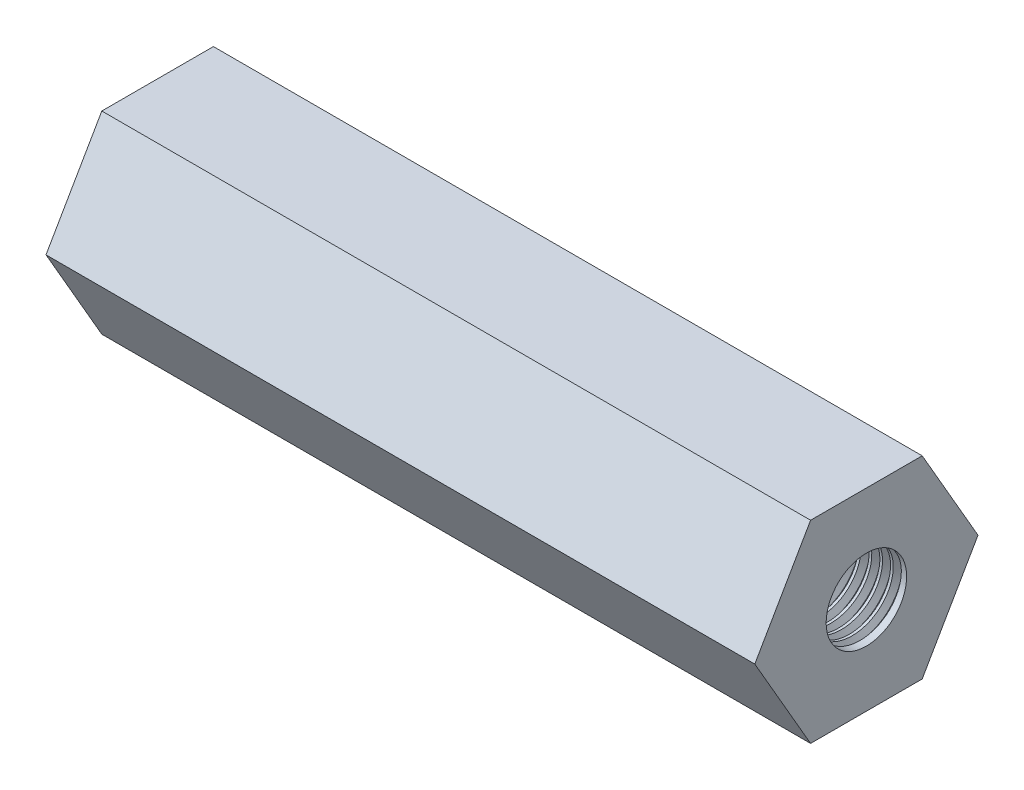
from build123d import *

# Parameters (mm, degrees)
SKETCH2_R           = 3.96875
BOSS_EXTRUDE1_DEPTH = 34.925
THREAD1_PITCH       = 1.058333333
THREAD2_PITCH       = 1.058333333


with BuildPart() as part:
    # Sketch2 → Boss-Extrude1 (new, symmetric)
    with BuildSketch(Plane(origin=(0, 0, 0), x_dir=(0, 0, -1), z_dir=(1, 0, 0))):
        Polygon((10.998522628, 0), (5.499261314, 9.525), (-5.499261314, 9.525), (-10.998522628, 0), (-5.499261314, -9.525), (5.499261314, -9.525), align=None)
        Circle(SKETCH2_R, mode=Mode.SUBTRACT)
    extrude(amount=BOSS_EXTRUDE1_DEPTH, both=True)

    # Thread1: the profile of Thread Profile1 profile screwed along a right-hand helix of 30 turns, 8 arcs to a turn; built about Z, then put on its axis
    thread1_z = Axis((0, 0, 0), (0, 0, 1))
    thread1_corners = [(3.96845, 0, -0.000173205), (4.541589718, 0, 0.330729165), (4.541589718, 0, 0.463020832), (3.96845, 0, 0.793923202)]
    with BuildLine(mode=Mode.PRIVATE) as thread1_profile:
        Line(thread1_corners[0], thread1_corners[1])
        Line(thread1_corners[1], thread1_corners[2])
        Line(thread1_corners[2], thread1_corners[3])
        Line(thread1_corners[3], thread1_corners[0])
    thread1_cap = Face(thread1_profile.wire())
    thread1_turn_angles = [0, 22.5, 45, 67.5, 90, 112.5, 135, 157.5, 180, 202.5, 225, 247.5, 270, 292.5, 315, 337.5, 360]
    thread1_turn_weights = [1, 0.9238795325112867, 1, 0.9238795325112867, 1, 0.9238795325112867, 1, 0.9238795325112867, 1, 0.9238795325112867, 1, 0.9238795325112867, 1, 0.9238795325112867, 1, 0.9238795325112867, 1]
    thread1_turn_rails = [Edge.make_bspline([Vector(p[0], p[1], 0).rotate(thread1_z, thread1_turn_angles[k]) / thread1_turn_weights[k] + Vector(0, 0, p[2] + THREAD1_PITCH * thread1_turn_angles[k] / 360) for k in range(17)], [0, 0, 0, 1, 1, 2, 2, 3, 3, 4, 4, 5, 5, 6, 6, 7, 7, 8, 8, 8], 2, thread1_turn_weights) for p in thread1_corners]
    thread1_turn_sides = [Face.make_surface_from_curves(thread1_turn_rails[p[0]], thread1_turn_rails[p[1]]) for p in [(0, 1), (1, 2), (2, 3), (3, 0)]]
    thread1 = Plane(origin=(34.925, 0, 0), x_dir=(0, 0, 1), z_dir=(-1, 0, 0)) * Solid(Shell([*[p.moved(Location((0, 0, THREAD1_PITCH * i))) for i in range(30) for p in thread1_turn_sides], thread1_cap, thread1_cap.rotate(thread1_z, 10800).moved(Location((0, 0, THREAD1_PITCH * 10800 / 360)))]))
    add(thread1, mode=Mode.SUBTRACT)

    # Thread2: the profile of Thread Profile2 profile screwed along a left-hand helix of 30 turns, 8 arcs to a turn; built about Z, then put on its axis
    thread2_z = Axis((0, 0, 0), (0, 0, 1))
    thread2_corners = [(3.96845, 0, -0.000173205), (4.541589718, 0, 0.330729165), (4.541589718, 0, 0.463020832), (3.96845, 0, 0.793923202)]
    with BuildLine(mode=Mode.PRIVATE) as thread2_profile:
        Line(thread2_corners[0], thread2_corners[1])
        Line(thread2_corners[1], thread2_corners[2])
        Line(thread2_corners[2], thread2_corners[3])
        Line(thread2_corners[3], thread2_corners[0])
    thread2_cap = Face(thread2_profile.wire())
    thread2_turn_angles = [0, -22.5, -45, -67.5, -90, -112.5, -135, -157.5, -180, -202.5, -225, -247.5, -270, -292.5, -315, -337.5, -360]
    thread2_turn_weights = [1, 0.9238795325112867, 1, 0.9238795325112867, 1, 0.9238795325112867, 1, 0.9238795325112867, 1, 0.9238795325112867, 1, 0.9238795325112867, 1, 0.9238795325112867, 1, 0.9238795325112867, 1]
    thread2_turn_rails = [Edge.make_bspline([Vector(p[0], p[1], 0).rotate(thread2_z, thread2_turn_angles[k]) / thread2_turn_weights[k] + Vector(0, 0, p[2] + -THREAD2_PITCH * thread2_turn_angles[k] / 360) for k in range(17)], [0, 0, 0, 1, 1, 2, 2, 3, 3, 4, 4, 5, 5, 6, 6, 7, 7, 8, 8, 8], 2, thread2_turn_weights) for p in thread2_corners]
    thread2_turn_sides = [Face.make_surface_from_curves(thread2_turn_rails[p[0]], thread2_turn_rails[p[1]]) for p in [(0, 1), (1, 2), (2, 3), (3, 0)]]
    thread2 = Plane(origin=(-34.925, 0, 0), x_dir=(0, 0, -1), z_dir=(1, 0, 0)) * Solid(Shell([*[p.moved(Location((0, 0, THREAD2_PITCH * i))) for i in range(30) for p in thread2_turn_sides], thread2_cap, thread2_cap.rotate(thread2_z, -10800).moved(Location((0, 0, -THREAD2_PITCH * -10800 / 360)))]))
    add(thread2, mode=Mode.SUBTRACT)


solid = part.part
